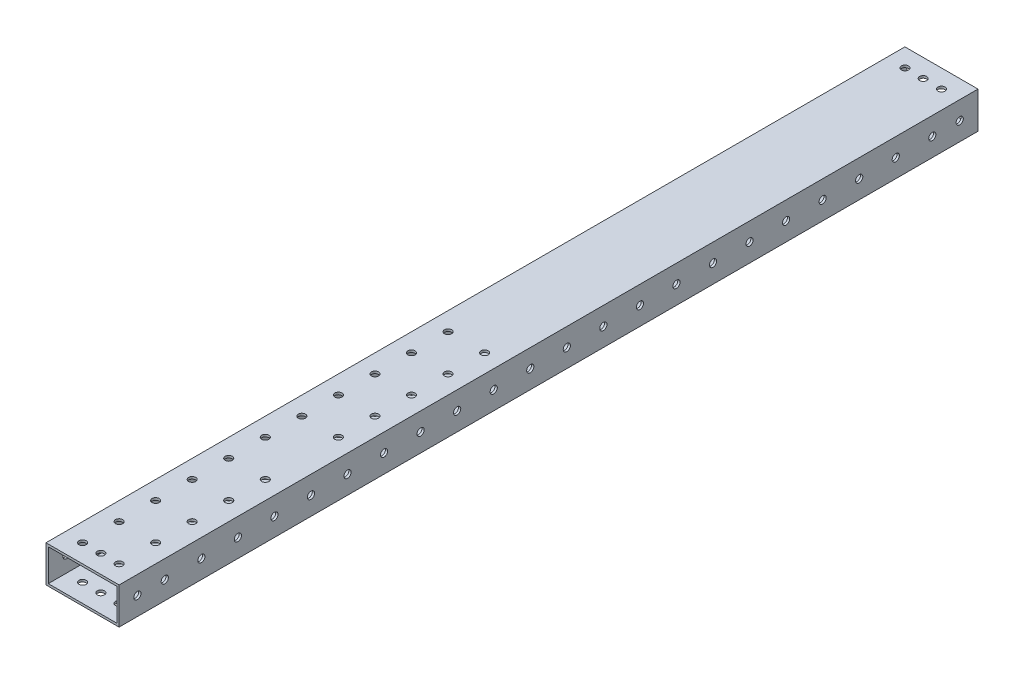
from build123d import *

# Parameters (mm, degrees)
SKETCH1_W           = 50.8
SKETCH1_H           = 25.4
BOSS_EXTRUDE1_DEPTH = 298.45
SHELL1_T            = -1.5875
SKETCH2_R           = 2.4892
CUT_EXTRUDE1_DEPTH  = 304.806192333
SKETCH3_R           = 2.4892
CUT_EXTRUDE2_DEPTH  = 304.806192333
SKETCH4_R           = 2.4892
CUT_EXTRUDE3_DEPTH  = 304.806192333
LPATTERN1_COUNT     = 22
LPATTERN1_PITCH     = 25.4
SKETCH5_R           = 2.4892
CUT_EXTRUDE4_DEPTH  = 304.806192333


with BuildPart() as part:
    # Sketch1 → Boss-Extrude1 (new, symmetric)
    with BuildSketch(Plane.XY):
        with Locations((25.4, 12.7)):
            Rectangle(SKETCH1_W, SKETCH1_H)
    extrude(amount=BOSS_EXTRUDE1_DEPTH, both=True)

    # Shell1
    shell1_openings = [part.faces().sort_by_distance(p)[0] for p in [
        (25.4, 12.7, -298.45),
        (25.4, 12.7, 298.45),
    ]]
    offset(amount=SHELL1_T, openings=shell1_openings, kind=Kind.INTERSECTION)

    # Sketch2 → Cut-Extrude1 (cut, through all)
    with BuildSketch(Plane(origin=(0, 25.4, 0), x_dir=(1, 0, 0), z_dir=(0, 1, 0))):
        with Locations((38.1, -285.75)):
            Circle(SKETCH2_R)
        with Locations((25.4, -285.75)):
            Circle(SKETCH2_R)
        with Locations((12.7, -285.75)):
            Circle(SKETCH2_R)
    cut_extrude1 = extrude(amount=-CUT_EXTRUDE1_DEPTH, mode=Mode.SUBTRACT)

    # Sketch3 → Cut-Extrude2 (cut, through all)
    with BuildSketch(Plane(origin=(50.8, 0, 0), x_dir=(0, 0, -1), z_dir=(1, 0, 0))):
        with Locations((-285.75, 12.7)):
            Circle(SKETCH3_R)
    cut_extrude2 = extrude(amount=-CUT_EXTRUDE2_DEPTH, mode=Mode.SUBTRACT)

    # Mirror1: Cut-Extrude1, Cut-Extrude2 across plane
    add(cut_extrude1.mirror(Plane.XY), mode=Mode.SUBTRACT)
    add(cut_extrude2.mirror(Plane.XY), mode=Mode.SUBTRACT)

    # Sketch4 → Cut-Extrude3 (cut, symmetric)
    with BuildSketch(Plane(origin=(50.8, 0, 0), x_dir=(0, 0, -1), z_dir=(1, 0, 0))):
        with Locations((-266.7, 12.7)):
            Circle(SKETCH4_R)
    cut_extrude3 = extrude(amount=CUT_EXTRUDE3_DEPTH, both=True, mode=Mode.SUBTRACT)

    # LPattern1: Cut-Extrude3 ×22
    with Locations(*[(0, 0, -i * LPATTERN1_PITCH) for i in range(1, LPATTERN1_COUNT)]):
        add(cut_extrude3, mode=Mode.SUBTRACT)

    # Sketch5 → Cut-Extrude4 (cut, through all)
    with BuildSketch(Plane.XZ):
        with Locations((12.7, 158.75)):
            Circle(SKETCH5_R)
        with Locations((12.7, 184.15)):
            Circle(SKETCH5_R)
        with Locations((38.1, 184.15)):
            Circle(SKETCH5_R)
        with Locations((38.1, 209.55)):
            Circle(SKETCH5_R)
        with Locations((12.7, 209.55)):
            Circle(SKETCH5_R)
        with Locations((12.7, 234.95)):
            Circle(SKETCH5_R)
        with Locations((38.1, 234.95)):
            Circle(SKETCH5_R)
        with Locations((38.1, 260.35)):
            Circle(SKETCH5_R)
        with Locations((12.7, 260.35)):
            Circle(SKETCH5_R)
        with Locations((12.7, 31.75)):
            Circle(SKETCH5_R)
        with Locations((38.1, 31.75)):
            Circle(SKETCH5_R)
        with Locations((12.7, 57.15)):
            Circle(SKETCH5_R)
        with Locations((38.1, 57.15)):
            Circle(SKETCH5_R)
        with Locations((12.7, 82.55)):
            Circle(SKETCH5_R)
        with Locations((38.1, 82.55)):
            Circle(SKETCH5_R)
        with Locations((38.1, 107.95)):
            Circle(SKETCH5_R)
        with Locations((38.1, 133.35)):
            Circle(SKETCH5_R)
        with Locations((12.7, 107.95)):
            Circle(SKETCH5_R)
        with Locations((12.7, 133.35)):
            Circle(SKETCH5_R)
    extrude(amount=-CUT_EXTRUDE4_DEPTH, mode=Mode.SUBTRACT)


solid = part.part
